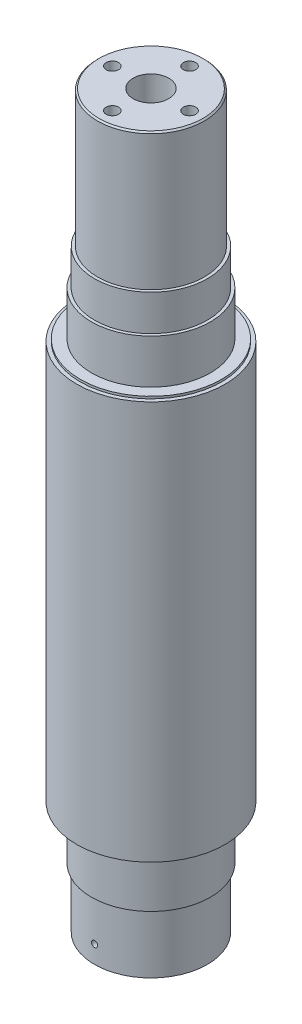
from build123d import *

# Parameters (mm, degrees)
BOSS_EXTRUDE1_DEPTH                    = 95
BOSS_EXTRUDE1_DEPTH_BACK               = 105
SKETCH1_R                              = 25
SKETCH2_R                              = 18
BOSS_EXTRUDE2_DEPTH                    = 46
CUT_EXTRUDE1_DEPTH                     = 10
CHAMFER1_SIZE                          = 0.5
SKETCH9_R                              = 10
CUT_EXTRUDE2_DEPTH                     = 30
CUT_EXTRUDE2_DRAFT                     = -8
SKETCH10_R                             = 6.5
CUT_EXTRUDE3_DEPTH                     = 50
SKETCH11_R                             = 6
CUT_EXTRUDE4_DEPTH                     = 249.527664456
CIRPATTERN1_COUNT                      = 4
CUT_EXTRUDE6_START                     = 69
SKETCH21_R                             = 25
SKETCH21_R_2                           = 20
CUT_EXTRUDE6_DEPTH                     = 27
CUT_EXTRUDE7_START                     = -105
SKETCH21_2_R                           = 25
SKETCH21_2_R_2                         = 20
CUT_EXTRUDE7_DEPTH                     = 39
CUT_EXTRUDE8_START                     = -27.75
SKETCH23_R                             = 25
SKETCH23_R_2                           = 23.75
CUT_EXTRUDE8_DEPTH                     = 0.75
SKETCH24_R                             = 20
SKETCH24_R_2                           = 19
CUT_EXTRUDE9_DEPTH                     = 20.1
M2_5X0_45_TAPPED_HOLE2_D               = 2.05
M2_5X0_45_TAPPED_HOLE2_DEPTH           = 5
M2_5X0_45_TAPPED_HOLE2_TIP             = 0.615882135
M2_5X0_45_TAPPED_HOLE2_ON_FACE_2_D     = 2.05
M2_5X0_45_TAPPED_HOLE2_ON_FACE_2_DEPTH = 5
M2_5X0_45_TAPPED_HOLE2_ON_FACE_2_TIP   = 0.615882135
CUT_EXTRUDE10_START                    = -12.1
SKETCH25_R                             = 20
SKETCH25_R_2                           = 19
CUT_EXTRUDE10_DEPTH                    = 12.1


with BuildPart() as part:
    # Sketch1 → Boss-Extrude1 (new, two sides: drawn at the far end of the back side and taken through both)
    with BuildSketch(Plane(origin=(0, 0, 0), x_dir=(1, 0, 0), z_dir=(0, 1, 0)).offset(-BOSS_EXTRUDE1_DEPTH_BACK)):
        Circle(SKETCH1_R)
    extrude(amount=BOSS_EXTRUDE1_DEPTH + BOSS_EXTRUDE1_DEPTH_BACK)

    # Sketch2 → Boss-Extrude2 (add)
    with BuildSketch(Plane(origin=(0, 95, 0), x_dir=(1, 0, 0), z_dir=(0, 1, 0))):
        Circle(SKETCH2_R)
    extrude(amount=BOSS_EXTRUDE2_DEPTH)

    # Sketch8 → Cut-Extrude1 (cut)
    with BuildSketch(Plane.XY.offset(-15)):
        with BuildLine():
            Line((3, 122), (3, 103))
            ThreePointArc((3, 103), (0, 100), (-3, 103))
            Line((-3, 103), (-3, 122))
            ThreePointArc((-3, 122), (0, 125), (3, 122))
        make_face()
    extrude(amount=-CUT_EXTRUDE1_DEPTH, mode=Mode.SUBTRACT)

    # Chamfer1
    chamfer1_edges = [part.edges().sort_by_distance(p)[0] for p in [
        (-18, 141, 0),
    ]]
    chamfer(chamfer1_edges, length=CHAMFER1_SIZE)


with BuildPart() as cut_extrude2_tool:
    # Sketch9 → Cut-Extrude2 (with draft: the straight prism first)
    with BuildSketch(Plane.XZ.offset(105)):
        Circle(SKETCH9_R)
    extrude(amount=-CUT_EXTRUDE2_DEPTH)
    # Cut-Extrude2: the draft: its side faces are tilted about the plane it starts from
    cut_extrude2_sides = [cut_extrude2_tool.faces().sort_by_distance(p)[0] for p in [
        (-10, -90, 0),
    ]]
    draft(cut_extrude2_sides, Plane.XZ.offset(105), CUT_EXTRUDE2_DRAFT)


with BuildPart() as part_1:
    add(part.part)

    # Cut-Extrude2: cut by cut_extrude2_tool
    add(cut_extrude2_tool.part, mode=Mode.SUBTRACT)

    # Sketch10 → Cut-Extrude3 (cut)
    with BuildSketch(Plane.XZ.offset(105)):
        Circle(SKETCH10_R)
    extrude(amount=-CUT_EXTRUDE3_DEPTH, mode=Mode.SUBTRACT)

    # Sketch11 → Cut-Extrude4 (cut, through all)
    with BuildSketch(Plane(origin=(0, 141, 0), x_dir=(1, 0, 0), z_dir=(0, 1, 0))):
        Circle(SKETCH11_R)
    extrude(amount=-CUT_EXTRUDE4_DEPTH, mode=Mode.SUBTRACT)

    # Sketch15 → M5x0.8 Tapped Hole1 (revolve, cut)
    with BuildSketch(Plane(origin=(0, 141, -13), x_dir=(0, 0, 1), z_dir=(1, 0, 0))):
        Polygon((0, 0), (0, 12), (2.1, 10.7381927), (2.1, 0), align=None)
    m5x0_8_tapped_hole1 = revolve(axis=Axis((0, 147.35, -13), (0, -1, 0)), mode=Mode.SUBTRACT)

    # CirPattern1: M5x0.8 Tapped Hole1 ×4 about axis
    cirpattern1_axis = Axis((0, -105, 0), (0, 1, 0))
    for i in range(1, CIRPATTERN1_COUNT):
        add(m5x0_8_tapped_hole1.rotate(cirpattern1_axis, i * 360 / CIRPATTERN1_COUNT), mode=Mode.SUBTRACT)

    # Sketch20 → M2.5x0.45 Tapped Hole1 (revolve, cut)
    with BuildSketch(Plane(origin=(12.2, -105, 0), x_dir=(0, 0, -1), z_dir=(1, 0, 0))):
        Polygon((0, 0), (0, 9.35), (1.025, 8.734117865), (1.025, 0), align=None)
    m2_5x0_45_tapped_hole1 = revolve(axis=Axis((12.2, -111.35, 0), (0, 1, 0)), mode=Mode.SUBTRACT)

    # Mirror2: M2.5x0.45 Tapped Hole1 across plane
    add(m2_5x0_45_tapped_hole1.mirror(Plane(origin=(0, 0, 0), x_dir=(0, 0, 1), z_dir=(1, 0, 0))), mode=Mode.SUBTRACT)

    # Sketch21 → Cut-Extrude6 (cut)
    with BuildSketch(Plane(origin=(0, -1, 0), x_dir=(1, 0, 0), z_dir=(0, 1, 0)).offset(CUT_EXTRUDE6_START)):
        Circle(SKETCH21_R)
        Circle(SKETCH21_R_2, mode=Mode.SUBTRACT)
    extrude(amount=CUT_EXTRUDE6_DEPTH, mode=Mode.SUBTRACT)

    # Sketch21<2> → Cut-Extrude7 (cut)
    with BuildSketch(Plane(origin=(0, -1, 0), x_dir=(1, 0, 0), z_dir=(0, 1, 0)).offset(CUT_EXTRUDE7_START)):
        Circle(SKETCH21_2_R)
        Circle(SKETCH21_2_R_2, mode=Mode.SUBTRACT)
    extrude(amount=CUT_EXTRUDE7_DEPTH, mode=Mode.SUBTRACT)

    # Sketch23 → Cut-Extrude8 (cut)
    with BuildSketch(Plane(origin=(0, 95, 0), x_dir=(1, 0, 0), z_dir=(0, 1, 0)).offset(CUT_EXTRUDE8_START)):
        Circle(SKETCH23_R)
        Circle(SKETCH23_R_2, mode=Mode.SUBTRACT)
    extrude(amount=CUT_EXTRUDE8_DEPTH, mode=Mode.SUBTRACT)

    # Sketch24 → Cut-Extrude9 (cut)
    with BuildSketch(Plane.XZ.offset(105)):
        Circle(SKETCH24_R)
        Circle(SKETCH24_R_2, mode=Mode.SUBTRACT)
    extrude(amount=-CUT_EXTRUDE9_DEPTH, mode=Mode.SUBTRACT)

    # M2.5x0.45 Tapped Hole2
    with Locations(Plane(origin=(0, -99, -19), x_dir=(-1, 0, 0), z_dir=(0, 0, -1))):
        with Locations((0, 0)):
            Hole(M2_5X0_45_TAPPED_HOLE2_D / 2, depth=M2_5X0_45_TAPPED_HOLE2_DEPTH)
            with Locations((0, 0, -(M2_5X0_45_TAPPED_HOLE2_DEPTH + M2_5X0_45_TAPPED_HOLE2_TIP / 2))):  # 118° drill point
                Cone(0, M2_5X0_45_TAPPED_HOLE2_D / 2, M2_5X0_45_TAPPED_HOLE2_TIP, mode=Mode.SUBTRACT)

    # M2.5x0.45 Tapped Hole2 on face 2
    with Locations(Plane(origin=(0, -99, 19), x_dir=(1, 0, 0), z_dir=(0, 0, 1))):
        with Locations((0, 0)):
            Hole(M2_5X0_45_TAPPED_HOLE2_ON_FACE_2_D / 2, depth=M2_5X0_45_TAPPED_HOLE2_ON_FACE_2_DEPTH)
            with Locations((0, 0, -(M2_5X0_45_TAPPED_HOLE2_ON_FACE_2_DEPTH + M2_5X0_45_TAPPED_HOLE2_ON_FACE_2_TIP / 2))):  # 118° drill point
                Cone(0, M2_5X0_45_TAPPED_HOLE2_ON_FACE_2_D / 2, M2_5X0_45_TAPPED_HOLE2_ON_FACE_2_TIP, mode=Mode.SUBTRACT)

    # Sketch25 → Cut-Extrude10 (cut)
    with BuildSketch(Plane(origin=(0, 95, 0), x_dir=(1, 0, 0), z_dir=(0, 1, 0)).offset(CUT_EXTRUDE10_START)):
        Circle(SKETCH25_R)
        Circle(SKETCH25_R_2, mode=Mode.SUBTRACT)
    extrude(amount=CUT_EXTRUDE10_DEPTH, mode=Mode.SUBTRACT)


solid = part_1.part
